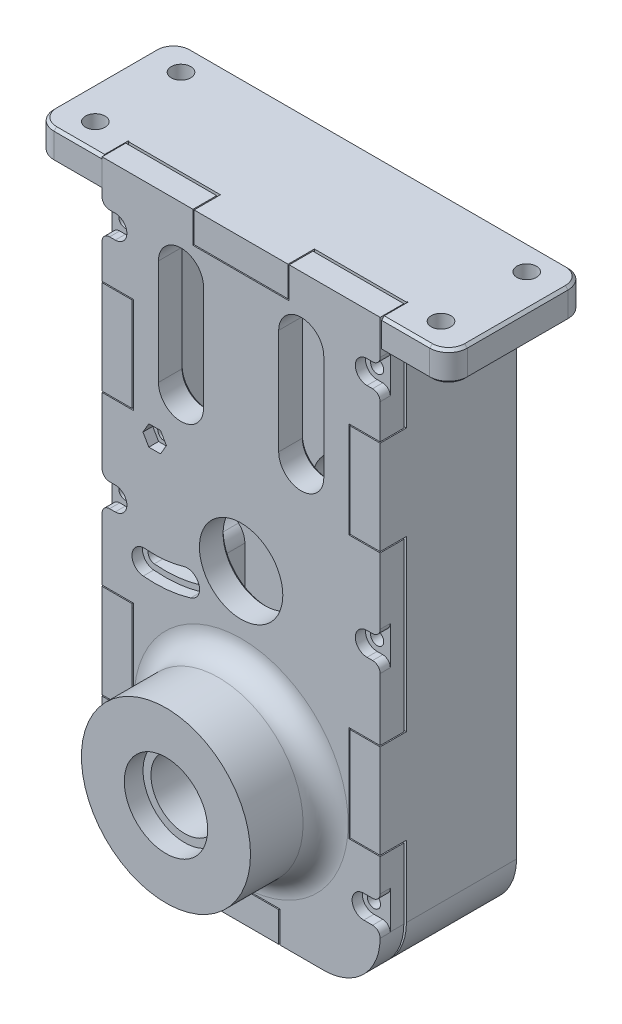
from build123d import *

# Parameters (mm, degrees)
SKETCH1_W            = 42
SKETCH1_H            = 42
BOSS_EXTRUDE1_DEPTH  = 7
SKETCH3_W            = 74
SKETCH3_H            = 158
SKETCH3_W_2          = 58
SKETCH3_H_2          = 142
BOSS_EXTRUDE2_DEPTH  = 30
CUT_EXTRUDE2_REACH   = 138.158
SKETCH4_R            = 9
SKETCH4_5_R          = 11.1
CUT_EXTRUDE3_DEPTH   = 5
CUT_EXTRUDE21_START  = 2
SKETCH4_6_R          = 11.1
SKETCH4_6_R_2        = 9
CUT_EXTRUDE21_DEPTH  = 5
SKETCH5_W            = 8
SKETCH5_H            = 25
SKETCH5_W_2          = 20
SKETCH5_H_2          = 8
SKETCH5_W_3          = 25
BOSS_EXTRUDE4_DEPTH  = 7
BOSS_EXTRUDE5_DEPTH  = 7
BOSS_EXTRUDE15_START = 20
SKETCH28_R           = 22.5
SKETCH28_R_2         = 9
BOSS_EXTRUDE15_DEPTH = 20
CUT_EXTRUDE4_START   = -27
SKETCH8_R            = 9
SKETCH8_R_2          = 11.1
CUT_EXTRUDE4_DEPTH   = 7
SKETCH8_3_R          = 11.1
SKETCH8_3_R_2        = 9
CUT_EXTRUDE5_DEPTH   = 5
SKETCH9_R            = 1.8
CUT_EXTRUDE7_DEPTH   = 7
CUT_EXTRUDE8_DEPTH   = 2.8
CUT_EXTRUDE9_DEPTH   = 2.6
CUT_EXTRUDE10_DEPTH  = 23
FILLET3_R            = 15
FILLET4_R            = 7
FILLET5_R            = 15
SKETCH14_R           = 1.75
CUT_EXTRUDE11_DEPTH  = 2.7
SKETCH14_2_R         = 1.75
CUT_EXTRUDE12_DEPTH  = 7
SKETCH15_R           = 1.5
CUT_EXTRUDE13_DEPTH  = 16
CUT_EXTRUDE14_DEPTH  = 7
FILLET6_R            = 2
SKETCH17_W           = 110
SKETCH17_H           = 29.8
BOSS_EXTRUDE8_DEPTH  = 8
SKETCH18_W           = 17.8
SKETCH18_H           = 8
BOSS_EXTRUDE10_DEPTH = 7
SKETCH19_R           = 2.6
CUT_EXTRUDE15_DEPTH  = 2.5
SKETCH19_3_R         = 2.6
CUT_EXTRUDE16_DEPTH  = 170.629006953
FILLET7_R            = 5
CHAMFER1_SIZE        = 0.7
CHAMFER2_SIZE        = 0.7
FILLET8_R            = 5
FILLET12_R           = 6


with BuildPart() as part:
    # Sketch1 → Boss-Extrude1 (new body)
    # profile 1 of 2: a face of its own
    with BuildSketch(Plane.XY):
        Polygon((21, -21), (-21, -21), (-21, 21), (-29, 21), (-29, -121), (29, -121), (29, 21), (21, 21), align=None)
    # profile 2 of 2: a face of its own
    with BuildSketch(Plane.XY):
        Rectangle(SKETCH1_W, SKETCH1_H)
        with BuildLine():
            ThreePointArc((11.1, 3.5), (0, 14.6), (-11.1, 3.5))
            Line((-11.1, 3.5), (-11.1, -3.5))
            ThreePointArc((-11.1, -3.5), (0, -14.6), (11.1, -3.5))
            Line((11.1, -3.5), (11.1, 3.5))
        make_face(mode=Mode.SUBTRACT)
        with BuildLine():
            ThreePointArc((17.3, -12), (15.5, -10.2), (13.7, -12))
            Line((13.7, -12), (13.7, -19))
            ThreePointArc((13.7, -19), (15.5, -20.8), (17.3, -19))
            Line((17.3, -19), (17.3, -12))
        make_face(mode=Mode.SUBTRACT)
        with BuildLine():
            ThreePointArc((-13.7, -12), (-15.5, -10.2), (-17.3, -12))
            Line((-17.3, -12), (-17.3, -19))
            ThreePointArc((-17.3, -19), (-15.5, -20.8), (-13.7, -19))
            Line((-13.7, -19), (-13.7, -12))
        make_face(mode=Mode.SUBTRACT)
        with BuildLine():
            ThreePointArc((-13.7, 19), (-15.5, 20.8), (-17.3, 19))
            Line((-17.3, 19), (-17.3, 12))
            ThreePointArc((-17.3, 12), (-15.5, 10.2), (-13.7, 12))
            Line((-13.7, 12), (-13.7, 19))
        make_face(mode=Mode.SUBTRACT)
        with BuildLine():
            ThreePointArc((17.3, 19), (15.5, 20.8), (13.7, 19))
            Line((13.7, 19), (13.7, 12))
            ThreePointArc((13.7, 12), (15.5, 10.2), (17.3, 12))
            Line((17.3, 12), (17.3, 19))
        make_face(mode=Mode.SUBTRACT)
    extrude(amount=BOSS_EXTRUDE1_DEPTH)

    # Sketch3 → Boss-Extrude2 (add)
    with BuildSketch(Plane.XY):
        with Locations((0, -50)):
            Rectangle(SKETCH3_W, SKETCH3_H)
        with Locations((0, -50)):
            Rectangle(SKETCH3_W_2, SKETCH3_H_2, mode=Mode.SUBTRACT)
    extrude(amount=BOSS_EXTRUDE2_DEPTH)

    # Sketch4 → Cut-Extrude2 (cut, up to next)
    with BuildSketch(Plane(origin=(0, 0, 7), x_dir=(-1, 0, 0), z_dir=(0, 0, -1)), mode=Mode.PRIVATE) as cut_extrude2_sk1:
        with Locations(Location((0, -92, 0), (0, 0, 180))):
            Circle(SKETCH4_R)
    cut_extrude2_tool1 = extrude(cut_extrude2_sk1.sketch, amount=CUT_EXTRUDE2_REACH, mode=Mode.PRIVATE) & part.part
    # Sketch4 → Cut-Extrude2 (cut, up to next)
    with BuildSketch(Plane(origin=(0, 0, 7), x_dir=(-1, 0, 0), z_dir=(0, 0, -1)), mode=Mode.PRIVATE) as cut_extrude2_sk2:
        with Locations(Location((0, -48, 0), (0, 0, 180))):
            Circle(SKETCH4_R)
    cut_extrude2_tool2 = extrude(cut_extrude2_sk2.sketch, amount=CUT_EXTRUDE2_REACH, mode=Mode.PRIVATE) & part.part
    add(cut_extrude2_tool1.solids().sort_by_distance((0, -92, 7))[0], mode=Mode.SUBTRACT)
    add(cut_extrude2_tool2.solids().sort_by_distance((0, -48, 7))[0], mode=Mode.SUBTRACT)

    # Sketch4<5> → Cut-Extrude3 (cut)
    with BuildSketch(Plane(origin=(0, 0, 7), x_dir=(-1, 0, 0), z_dir=(0, 0, -1))):
        with Locations((0, -48)):
            Circle(SKETCH4_5_R)
    extrude(amount=CUT_EXTRUDE3_DEPTH, mode=Mode.SUBTRACT)

    # Sketch4<6> → Cut-Extrude21 (cut)
    with BuildSketch(Plane(origin=(0, 0, 7), x_dir=(-1, 0, 0), z_dir=(0, 0, -1)).offset(CUT_EXTRUDE21_START)):
        with Locations(Location((0, -92, 0), (0, 0, 180))):
            Circle(SKETCH4_6_R)
        with Locations(Location((0, -92, 0), (0, 0, 180))):
            Circle(SKETCH4_6_R_2, mode=Mode.SUBTRACT)
    extrude(amount=CUT_EXTRUDE21_DEPTH, mode=Mode.SUBTRACT)

    # Sketch5 → Boss-Extrude4 (add)
    with BuildSketch(Plane.XY.offset(30)):
        with Locations((-33, -12.5)):
            Rectangle(SKETCH5_W, SKETCH5_H)
        with Locations((-33, -82.5)):
            Rectangle(SKETCH5_W, SKETCH5_H)
        with Locations((0, -125)):
            Rectangle(SKETCH5_W_2, SKETCH5_H_2)
        with Locations((33, -82.5)):
            Rectangle(SKETCH5_W, SKETCH5_H)
        with Locations((33, -12.5)):
            Rectangle(SKETCH5_W, SKETCH5_H)
        with Locations((0, 25)):
            Rectangle(SKETCH5_W_3, SKETCH5_H_2)
    extrude(amount=BOSS_EXTRUDE4_DEPTH)

    # Sketch12 → Cut-Extrude10 (cut)
    with BuildSketch(Plane.XY.offset(30)):
        with BuildLine():
            Line((-29, -49.5), (-29, -68.5))
            ThreePointArc((-29, -68.5), (-34.454731747, -59), (-29, -49.5))
        make_face()
    extrude(amount=-CUT_EXTRUDE10_DEPTH, mode=Mode.SUBTRACT)

    # Fillet3
    fillet3_edges = [part.edges().sort_by_distance(p)[0] for p in [
        (37, -129, 15),
        (-37, -129, 15),
    ]]
    fillet(fillet3_edges, radius=FILLET3_R)

    # Fillet4
    fillet4_edges = [part.edges().sort_by_distance(p)[0] for p in [
        (-29, -121, 18.5),
        (29, -121, 18.5),
    ]]
    fillet(fillet4_edges, radius=FILLET4_R)

    # Sketch15 → Cut-Extrude13 (cut)
    with BuildSketch(Plane.XY.offset(37)):
        with Locations((33.5, 14.65)):
            Circle(SKETCH15_R)
        with Locations((33.5, -48)):
            Circle(SKETCH15_R)
        with Locations((32.642135624, -109)):
            Circle(SKETCH15_R)
        with Locations((-32.642135624, -109)):
            Circle(SKETCH15_R)
        with Locations((-33.5, -48)):
            Circle(SKETCH15_R)
        with Locations((-33.5, 14.65)):
            Circle(SKETCH15_R)
    extrude(amount=-CUT_EXTRUDE13_DEPTH, mode=Mode.SUBTRACT)

    # Sketch17 → Boss-Extrude8 (add)
    with BuildSketch(Plane(origin=(0, 29, 0), x_dir=(1, 0, 0), z_dir=(0, 1, 0))):
        with Locations((0, -14.9)):
            Rectangle(SKETCH17_W, SKETCH17_H)
    extrude(amount=-BOSS_EXTRUDE8_DEPTH)

    # Sketch18 → Boss-Extrude10 (add)
    with BuildSketch(Plane.XY.offset(29.8)):
        with Locations((-46.1, 25)):
            Rectangle(SKETCH18_W, SKETCH18_H)
        with Locations((46.1, 25)):
            Rectangle(SKETCH18_W, SKETCH18_H)
    extrude(amount=BOSS_EXTRUDE10_DEPTH)

    # Sketch19 → Cut-Extrude15 (cut)
    # profile 1 of 4: a face of its own
    with BuildSketch(Plane.XZ.offset(-21)):
        Polygon((40.457437416, 29.8), (43.228718708, 34.6), (48.771281292, 34.6), (51.542562584, 29.8), (48.771281292, 25), (43.228718708, 25), align=None)
        with Locations(Location((46, 29.8, 0), (0, 0, 270))):
            Circle(SKETCH19_R, mode=Mode.SUBTRACT)
    # profile 2 of 4: a face of its own
    with BuildSketch(Plane.XZ.offset(-21)):
        Polygon((43.228718708, 11.8), (48.771281292, 11.8), (51.542562584, 7), (48.771281292, 2.2), (43.228718708, 2.2), (40.457437416, 7), align=None)
        with Locations(Location((46, 7, 0), (0, 0, 270))):
            Circle(SKETCH19_R, mode=Mode.SUBTRACT)
    # profile 3 of 4: a face of its own
    with BuildSketch(Plane.XZ.offset(-21)):
        Polygon((-43.228718708, 2.2), (-40.457437416, 7), (-43.228718708, 11.8), (-48.771281292, 11.8), (-51.542562584, 7), (-48.771281292, 2.2), align=None)
        with Locations(Location((-46, 7, 0), (0, 0, 270))):
            Circle(SKETCH19_R, mode=Mode.SUBTRACT)
    # profile 4 of 4: a face of its own
    with BuildSketch(Plane.XZ.offset(-21)):
        Polygon((-48.771281292, 25), (-43.228718708, 25), (-40.457437416, 29.8), (-43.228718708, 34.6), (-48.771281292, 34.6), (-51.542562584, 29.8), align=None)
        with Locations(Location((-46, 29.8, 0), (0, 0, 270))):
            Circle(SKETCH19_R, mode=Mode.SUBTRACT)
    extrude(amount=-CUT_EXTRUDE15_DEPTH, mode=Mode.SUBTRACT)

    # Sketch19<3> → Cut-Extrude16 (cut, through all)
    with BuildSketch(Plane.XZ.offset(-21)):
        with Locations(Location((-46, 29.8, 0), (0, 0, 270))):
            Circle(SKETCH19_3_R)
        with Locations(Location((-46, 7, 0), (0, 0, 270))):
            Circle(SKETCH19_3_R)
        with Locations(Location((46, 7, 0), (0, 0, 270))):
            Circle(SKETCH19_3_R)
        with Locations(Location((46, 29.8, 0), (0, 0, 270))):
            Circle(SKETCH19_3_R)
    extrude(amount=-CUT_EXTRUDE16_DEPTH, mode=Mode.SUBTRACT)

    # Fillet7
    fillet7_edges = [part.edges().sort_by_distance(p)[0] for p in [
        (-55, 25, 0),
        (55, 25, 0),
        (55, 25, 36.8),
        (-55, 25, 36.8),
    ]]
    fillet(fillet7_edges, radius=FILLET7_R)

    # Chamfer1
    chamfer1_edges = [part.edges().sort_by_distance(p)[0] for p in [
        (-9, -48, 0),
        (-11.1, -92, 0),
        (37, -46.5, 0),
        (0, -129, 0),
        (-32.606601718, -124.606601718, 0),
        (32.606601718, -124.606601718, 0),
        (-37, -46.5, 0),
        (-43.5, 21, 0),
        (13.7, 15.5, 0),
        (15.5, 10.2, 0),
        (17.3, 15.5, 0),
        (15.5, 20.8, 0),
        (-17.3, 15.5, 0),
        (43.6, 21, 36.8),
        (-15.5, 10.2, 0),
        (-13.7, 15.5, 0),
        (-43.6, 29, 36.8),
        (-15.5, 20.8, 0),
        (-17.3, -15.5, 0),
        (-15.5, -20.8, 0),
        (-13.7, -15.5, 0),
        (-15.5, -10.2, 0),
        (13.7, -15.5, 0),
        (15.5, -20.8, 0),
        (17.3, -15.5, 0),
        (15.5, -10.2, 0),
        (-11.1, 0, 0),
        (0, -14.6, 0),
        (11.1, 0, 0),
        (0, 14.6, 0),
        (55, 29, 18.4),
        (55, 21, 18.4),
        (43.6, 29, 36.8),
        (0, 29, 0),
        (-55, 29, 18.4),
        (-53.535533906, 29, 35.335533906),
        (-53.535533906, 29, 1.464466094),
        (53.535533906, 29, 35.335533906),
        (53.535533906, 29, 1.464466094),
        (43.5, 21, 0),
        (53.535533906, 21, 35.335533906),
        (53.535533906, 21, 1.464466094),
        (-55, 21, 18.4),
        (-43.6, 21, 36.8),
        (-53.535533906, 21, 35.335533906),
        (-53.535533906, 21, 1.464466094),
    ]]
    chamfer(chamfer1_edges, length=CHAMFER1_SIZE)

    # Fillet8
    fillet8_edges = [part.edges().sort_by_distance(p)[0] for p in [
        (-29, -49.5, 18.5),
        (-29, -68.5, 18.5),
    ]]
    fillet(fillet8_edges, radius=FILLET8_R)


with BuildPart() as body_2:
    # Sketch7 → Boss-Extrude5 (new body)
    with BuildSketch(Plane.XY.offset(30)):
        Polygon((-37, -129), (-10.3, -129), (-10.3, -120.7), (10.3, -120.7), (10.3, -129), (37, -129), (37, -95.3), (28.7, -95.3), (28.7, -69.7), (37, -69.7), (37, -25.3), (28.7, -25.3), (28.7, 0.3), (37, 0.3), (37, 29), (12.8, 29), (12.8, 20.7), (-12.8, 20.7), (-12.8, 29), (-37, 29), (-37, 0.3), (-28.7, 0.3), (-28.7, -25.3), (-37, -25.3), (-37, -69.7), (-28.7, -69.7), (-28.7, -95.3), (-37, -95.3), align=None)
    extrude(amount=BOSS_EXTRUDE5_DEPTH)

    # Sketch28 → Boss-Extrude15 (add)
    with BuildSketch(Plane.XY.offset(37).offset(BOSS_EXTRUDE15_START)):
        with Locations((0, -92)):
            Circle(SKETCH28_R)
        with Locations((0, -92)):
            Circle(SKETCH28_R_2, mode=Mode.SUBTRACT)
    extrude(amount=-BOSS_EXTRUDE15_DEPTH)

    # Sketch8 → Cut-Extrude4 (cut)
    with BuildSketch(Plane.XY.offset(57).offset(CUT_EXTRUDE4_START)):
        with Locations((0, -92)):
            Circle(SKETCH8_R)
        with Locations((0, -48)):
            Circle(SKETCH8_R_2)
    extrude(amount=CUT_EXTRUDE4_DEPTH, mode=Mode.SUBTRACT)

    # Sketch8<3> → Cut-Extrude5 (cut)
    with BuildSketch(Plane.XY.offset(57)):
        with Locations((0, -92)):
            Circle(SKETCH8_3_R)
        with Locations((0, -92)):
            Circle(SKETCH8_3_R_2, mode=Mode.SUBTRACT)
    extrude(amount=-CUT_EXTRUDE5_DEPTH, mode=Mode.SUBTRACT)

    # Sketch9 → Cut-Extrude7 (cut)
    with BuildSketch(Plane.XY.offset(37)):
        with BuildLine():
            ThreePointArc((-25.915736751, -60.666046157), (-19.82, -60.6406005), (-13.841114362, -59.452500946))
            ThreePointArc((-13.841114362, -59.452500946), (-12.635815382, -57.210346989), (-14.87796934, -56.005048009))
            ThreePointArc((-14.87796934, -56.005048009), (-20.18, -57.058645726), (-25.585653345, -57.081210743))
            ThreePointArc((-25.585653345, -57.081210743), (-27.543112755, -58.708586747), (-25.915736751, -60.666046157))
        make_face()
        with Locations((-23, -29)):
            Circle(SKETCH9_R)
    extrude(amount=-CUT_EXTRUDE7_DEPTH, mode=Mode.SUBTRACT)

    # Sketch10 → Cut-Extrude8 (cut)
    with BuildSketch(Plane.XY.offset(37)):
        with BuildLine():
            ThreePointArc((-26.053271504, -62.159727579), (-19.67, -62.133081656), (-13.409091455, -60.88893967))
            ThreePointArc((-13.409091455, -60.88893967), (-11.199376659, -56.778324081), (-15.309992247, -54.568609285))
            ThreePointArc((-15.309992247, -54.568609285), (-20.33, -55.566164571), (-25.448118593, -55.58752932))
            ThreePointArc((-25.448118593, -55.58752932), (-29.036794178, -58.571051994), (-26.053271504, -62.159727579))
        make_face()
    extrude(amount=-CUT_EXTRUDE8_DEPTH, mode=Mode.SUBTRACT)

    # Sketch11 → Cut-Extrude9 (cut)
    with BuildSketch(Plane.XY.offset(37)):
        Polygon((-21.441154273, -26.3), (-24.558845727, -26.3), (-26.117691454, -29), (-24.558845727, -31.7), (-21.441154273, -31.7), (-19.882308546, -29), align=None)
    extrude(amount=-CUT_EXTRUDE9_DEPTH, mode=Mode.SUBTRACT)

    # Fillet5
    fillet5_edges = [body_2.edges().sort_by_distance(p)[0] for p in [
        (37, -129, 33.5),
        (-37, -129, 33.5),
    ]]
    fillet(fillet5_edges, radius=FILLET5_R)

    # Sketch14 → Cut-Extrude11 (cut)
    # profile 1 of 6: a face of its own
    with BuildSketch(Plane.XY.offset(37)):
        with BuildLine():
            Line((33.5, -44.9), (40.5, -44.9))
            ThreePointArc((40.5, -44.9), (43.6, -48), (40.5, -51.1))
            Line((40.5, -51.1), (33.5, -51.1))
            ThreePointArc((33.5, -51.1), (30.4, -48), (33.5, -44.9))
        make_face()
        with Locations((33.5, -48)):
            Circle(SKETCH14_R, mode=Mode.SUBTRACT)
    # profile 2 of 6: a face of its own
    with BuildSketch(Plane.XY.offset(37)):
        with BuildLine():
            Line((32.642135624, -105.9), (39.642135624, -105.9))
            ThreePointArc((39.642135624, -105.9), (42.742135624, -109), (39.642135624, -112.1))
            Line((39.642135624, -112.1), (32.642135624, -112.1))
            ThreePointArc((32.642135624, -112.1), (29.542135624, -109), (32.642135624, -105.9))
        make_face()
        with Locations((32.642135624, -109)):
            Circle(SKETCH14_R, mode=Mode.SUBTRACT)
    # profile 3 of 6: a face of its own
    with BuildSketch(Plane.XY.offset(37)):
        with BuildLine():
            Line((-33.5, -44.9), (-40.5, -44.9))
            ThreePointArc((-40.5, -44.9), (-43.6, -48), (-40.5, -51.1))
            Line((-40.5, -51.1), (-33.5, -51.1))
            ThreePointArc((-33.5, -51.1), (-30.4, -48), (-33.5, -44.9))
        make_face()
        with Locations((-33.5, -48)):
            Circle(SKETCH14_R, mode=Mode.SUBTRACT)
    # profile 4 of 6: a face of its own
    with BuildSketch(Plane.XY.offset(37)):
        with BuildLine():
            Line((33.5, 17.75), (40.5, 17.75))
            ThreePointArc((40.5, 17.75), (43.6, 14.65), (40.5, 11.55))
            Line((40.5, 11.55), (33.5, 11.55))
            ThreePointArc((33.5, 11.55), (30.4, 14.65), (33.5, 17.75))
        make_face()
        with Locations((33.5, 14.65)):
            Circle(SKETCH14_R, mode=Mode.SUBTRACT)
    # profile 5 of 6: a face of its own
    with BuildSketch(Plane.XY.offset(37)):
        with BuildLine():
            Line((-32.642135624, -105.9), (-39.642135624, -105.9))
            ThreePointArc((-39.642135624, -105.9), (-42.742135624, -109), (-39.642135624, -112.1))
            Line((-39.642135624, -112.1), (-32.642135624, -112.1))
            ThreePointArc((-32.642135624, -112.1), (-29.542135624, -109), (-32.642135624, -105.9))
        make_face()
        with Locations((-32.642135624, -109)):
            Circle(SKETCH14_R, mode=Mode.SUBTRACT)
    # profile 6 of 6: a face of its own
    with BuildSketch(Plane.XY.offset(37)):
        with BuildLine():
            Line((-33.5, 17.75), (-40.5, 17.75))
            ThreePointArc((-40.5, 17.75), (-43.6, 14.65), (-40.5, 11.55))
            Line((-40.5, 11.55), (-33.5, 11.55))
            ThreePointArc((-33.5, 11.55), (-30.4, 14.65), (-33.5, 17.75))
        make_face()
        with Locations((-33.5, 14.65)):
            Circle(SKETCH14_R, mode=Mode.SUBTRACT)
    extrude(amount=-CUT_EXTRUDE11_DEPTH, mode=Mode.SUBTRACT)

    # Sketch14<2> → Cut-Extrude12 (cut)
    with BuildSketch(Plane.XY.offset(37)):
        with Locations((-32.642135624, -109)):
            Circle(SKETCH14_2_R)
        with Locations((-33.5, -48)):
            Circle(SKETCH14_2_R)
        with Locations((-33.5, 14.65)):
            Circle(SKETCH14_2_R)
        with Locations((33.5, 14.65)):
            Circle(SKETCH14_2_R)
        with Locations((33.5, -48)):
            Circle(SKETCH14_2_R)
        with Locations((32.642135624, -109)):
            Circle(SKETCH14_2_R)
    extrude(amount=-CUT_EXTRUDE12_DEPTH, mode=Mode.SUBTRACT)

    # Sketch16 → Cut-Extrude14 (cut)
    with BuildSketch(Plane.XY.offset(37)):
        with BuildLine():
            Line((-10, 12.5), (-10, -15.5))
            ThreePointArc((-10, -15.5), (-16, -21.5), (-22, -15.5))
            Line((-22, -15.5), (-22, 12.5))
            ThreePointArc((-22, 12.5), (-16, 18.5), (-10, 12.5))
        make_face()
        with BuildLine():
            Line((10, 12.5), (10, -15.5))
            ThreePointArc((10, -15.5), (16, -21.5), (22, -15.5))
            Line((22, -15.5), (22, 12.5))
            ThreePointArc((22, 12.5), (16, 18.5), (10, 12.5))
        make_face()
    extrude(amount=-CUT_EXTRUDE14_DEPTH, mode=Mode.SUBTRACT)

    # Fillet6
    # the kernel refuses this fillet: 2 mm, written as the material it takes off along each edge
    with BuildSketch(Plane(origin=(-37, 11.55, 42), x_dir=(0, -1, 0), z_dir=(0, 0, -1)), Plane(origin=(-37, 17.75, 34.3), x_dir=(0, 1, 0), z_dir=(0, 0, 1)), Plane(origin=(-37, -105.9, 34.3), x_dir=(0, 1, 0), z_dir=(0, 0, 1)), Plane(origin=(-37, -51.1, 42), x_dir=(0, -1, 0), z_dir=(0, 0, -1)), Plane(origin=(-37, -44.9, 34.3), x_dir=(0, 1, 0), z_dir=(0, 0, 1))) as fillet6_piece_1:
        with BuildLine():
            CenterArc((FILLET6_R, -FILLET6_R), FILLET6_R, 90, 90)
            Line((0, -FILLET6_R), (0, 0))
            Line((0, 0), (FILLET6_R, 0))
        make_face()
    extrude(amount=7.7, mode=Mode.SUBTRACT)
    with BuildSketch(Plane(origin=(37, -105.9, 34.3), x_dir=(0, 1, 0), z_dir=(0, 0, 1)), Plane(origin=(37, 17.75, 34.3), x_dir=(0, 1, 0), z_dir=(0, 0, 1)), Plane(origin=(37, 11.55, 42), x_dir=(0, -1, 0), z_dir=(0, 0, -1)), Plane(origin=(37, -44.9, 34.3), x_dir=(0, 1, 0), z_dir=(0, 0, 1)), Plane(origin=(37, -51.1, 42), x_dir=(0, -1, 0), z_dir=(0, 0, -1))) as fillet6_piece_2:
        with BuildLine():
            CenterArc((FILLET6_R, FILLET6_R), FILLET6_R, 180, 90)
            Line((0, FILLET6_R), (0, 0))
            Line((0, 0), (FILLET6_R, 0))
        make_face()
    extrude(amount=7.7, mode=Mode.SUBTRACT)
    with BuildSketch(Plane(origin=(37, -112.1, 42.038461661), x_dir=(-0.0002202028998266684, -0.9999999757553413, 0), z_dir=(0, 0, -1))) as fillet6_piece_3:
        with BuildLine():
            CenterArc((2.000440442, 1.999944167), FILLET6_R, 179.987383303, 90.440741112)
            Line((0.00044049, 2.000384573), (-0.199559505, 2.000428613))
            Line((-0.199559505, 2.000428613), (-0.199999995, 4.4041e-05))
            Line((-0.199999995, 4.4041e-05), (-4.4041e-05, -0.199999995))
            ThreePointArc((-4.4041e-05, -0.199999995), (1.899955913, -0.200418381), (2.016879086, -0.199994417))
            Line((2.016879086, -0.199994417), (2.015384664, 0))
        make_face()
    extrude(amount=7.738461661, mode=Mode.SUBTRACT)
    with BuildSketch(Plane(origin=(-37, -112.1, 42.038461661), x_dir=(0.0002202028998301955, -0.999999975755341, 0), z_dir=(0, 0, -1))) as fillet6_piece_4:
        with BuildLine():
            CenterArc((2.000440442, -1.999944167), FILLET6_R, 89.571875585, 90.440741112)
            Line((0.00044049, -2.000384573), (-0.199559505, -2.000428613))
            Line((-0.199559505, -2.000428613), (-0.199999995, -4.4041e-05))
            Line((-0.199999995, -4.4041e-05), (-4.4041e-05, 0.199999995))
            ThreePointArc((-4.4041e-05, 0.199999995), (1.899955913, 0.200418381), (2.016879086, 0.199994417))
            Line((2.016879086, 0.199994417), (2.015384664, 0))
        make_face()
    extrude(amount=7.738461661, mode=Mode.SUBTRACT)

    # Chamfer2
    chamfer2_edges = [body_2.edges().sort_by_distance(p)[0] for p in [
        (-11.1, -48, 30),
        (-9, -92, 30),
        (-19.82, -60.6406005, 30),
        (-27.543112755, -58.708586747, 30),
        (-12.635815382, -57.210346989, 30),
        (-20.18, -57.058645726, 30),
        (-24.8, -29, 30),
        (37, -104.65, 30),
        (-16.15, -129, 30),
        (-32.606601718, -124.606601718, 30),
        (32.606601718, -124.606601718, 30),
        (-12.8, 24.85, 30),
        (0, 20.7, 30),
        (12.8, 24.85, 30),
        (24.9, 29, 30),
        (37, 14.65, 30),
        (32.85, 0.3, 30),
        (28.7, -12.5, 30),
        (32.85, -25.3, 30),
        (37, -47.5, 30),
        (32.85, -69.7, 30),
        (28.7, -82.5, 30),
        (30.892135624, -109, 30),
        (32.85, -95.3, 30),
        (31.75, -48, 30),
        (31.75, 14.65, 30),
        (-35.25, 14.65, 30),
        (-35.25, -48, 30),
        (16.15, -129, 30),
        (-34.392135624, -109, 30),
        (10.3, -124.85, 30),
        (0, -120.7, 30),
        (-10.3, -124.85, 30),
        (-16, 18.5, 30),
        (-10, -1.5, 30),
        (-16, -21.5, 30),
        (-22, -1.5, 30),
        (-37, -104.65, 30),
        (16, 18.5, 30),
        (22, -1.5, 30),
        (16, -21.5, 30),
        (10, -1.5, 30),
        (-32.85, -95.3, 30),
        (-28.7, -82.5, 30),
        (-32.85, -69.7, 30),
        (-37, -47.5, 30),
        (-32.85, -25.3, 30),
        (-28.7, -12.5, 30),
        (-32.85, 0.3, 30),
        (-37, 14.65, 30),
        (-24.9, 29, 30),
    ]]
    chamfer(chamfer2_edges, length=CHAMFER2_SIZE)

    # Fillet12
    fillet12_edges = [body_2.edges().sort_by_distance(p)[0] for p in [
        (-22.5, -92, 37),
    ]]
    fillet(fillet12_edges, radius=FILLET12_R)


solid = Compound([part.part, body_2.part])
